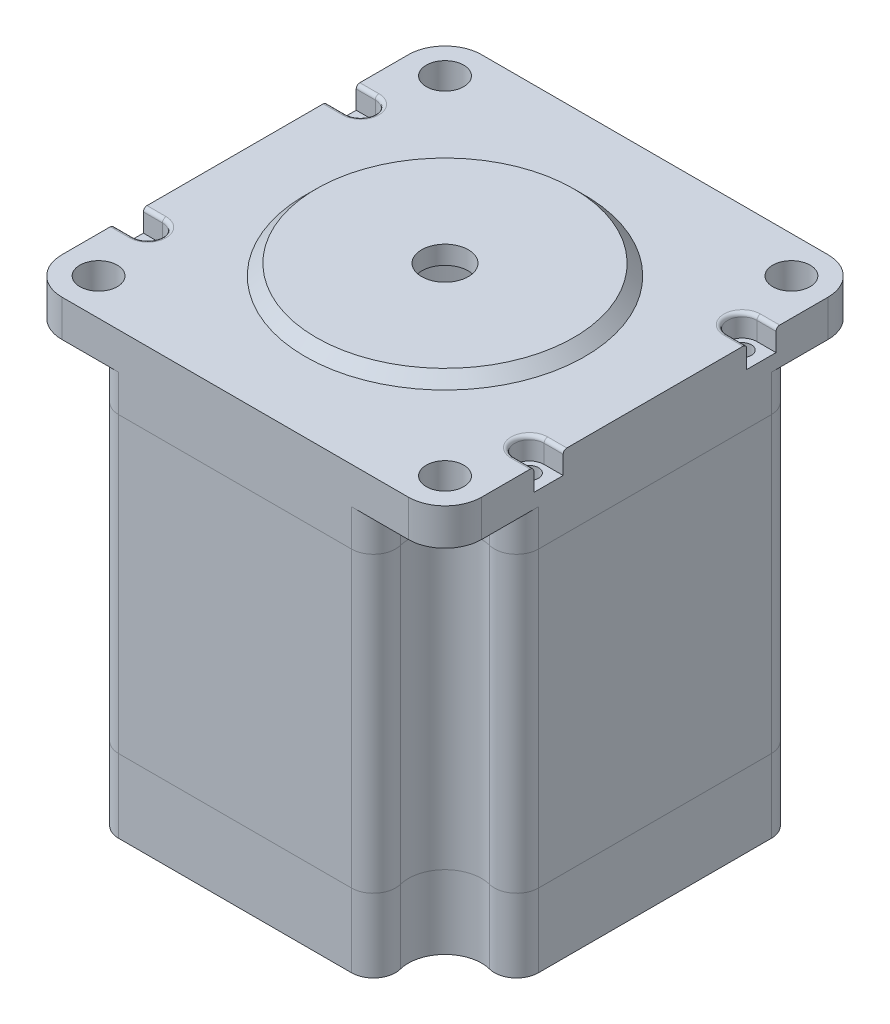
from build123d import *

# Parameters (mm, degrees)
BOSS_EXTRUDE1_DEPTH      = 30
SPLIT1_SURFACE_1_1_BACK  = 101.716
SPLIT1_SURFACE_1_1_DEPTH = 203.432
SPLIT1_SURFACE_1_2_BACK  = 101.716
SPLIT1_SURFACE_1_2_DEPTH = 203.432
SPLIT1_SURFACE_2_3_BACK  = 101.716
SPLIT1_SURFACE_2_3_DEPTH = 203.432
SPLIT1_SURFACE_2_4_BACK  = 101.716
SPLIT1_SURFACE_2_4_DEPTH = 203.432
SKETCH4_R                = 19.05
BOSS_EXTRUDE2_DEPTH      = 1.5
CHAMFER1_SIZE            = 1.5
SKETCH5_R                = 3.18
CUT_EXTRUDE1_DEPTH       = 74.60821964971032
FILLET1_R                = 1.5
CUT_EXTRUDE2_DEPTH       = 55
FILLET2_R                = 3
FILLET3_START            = 19
FILLET3_DEPTH            = 6
FILLET4_R                = 3
MIRROR1_START            = 20
MIRROR1_DEPTH            = 5
MIRROR1_START_2          = -20
MIRROR1_2_DEPTH          = 40
MIRROR1_START_3          = -30
MIRROR1_3_DEPTH          = 10
MIRROR2_START            = 20
MIRROR2_DEPTH            = 5
MIRROR2_START_2          = -20
MIRROR2_2_DEPTH          = 40
MIRROR2_START_3          = -30
MIRROR2_3_DEPTH          = 10
SKETCH7_R                = 2.5499999999999994
CUT_EXTRUDE3_DEPTH       = 73.35965743036655
FILLET5_R                = 5
SKETCH11_R               = 19.05
CUT_EXTRUDE4_DEPTH       = 29
CUT_EXTRUDE6_DEPTH       = 3
FILLET6_R                = 0.5
SKETCH16_R               = 1.2500000000000013
CUT_EXTRUDE8_DEPTH       = 73.35965743036655
CUT_EXTRUDE9_DEPTH       = 5


with BuildPart() as part:
    # Sketch1 → Boss-Extrude1 (new, symmetric)
    with BuildSketch(Plane(origin=(0, 0, 0), x_dir=(1, 0, 0), z_dir=(0, 1, 0))):
        Polygon((28.6, -28.600000000000005), (-28.6, -28.600000000000012), (-28.6, 28.59999999999999), (28.6, 28.599999999999998), align=None)
    extrude(amount=BOSS_EXTRUDE1_DEPTH, both=True)


with BuildPart() as body_2:
    # Split1: the piece behind the surface
    add(part.part)
    # Split1 surface 1: a surface, the sketch's curves swept straight by 203.432 mm
    with BuildLine(Plane(origin=(-3.47e-15, 0, -28.599999999999994), x_dir=(-1, 0, 1.2e-16), z_dir=(-1.2e-16, 0, -1)).offset(-SPLIT1_SURFACE_1_1_BACK), mode=Mode.PRIVATE) as split1_surface_1_1_path:
        Line((-28.600000000000005, 19.999999999999996), (28.599999999999998, 19.999999999999996))
    split1_surface_1_1 = Shell.extrude(split1_surface_1_1_path.wire(), (-1.2e-16 * SPLIT1_SURFACE_1_1_DEPTH, 0 * SPLIT1_SURFACE_1_1_DEPTH, -1 * SPLIT1_SURFACE_1_1_DEPTH))
    split(bisect_by=split1_surface_1_1, keep=Keep.BOTTOM)


with BuildPart() as part_1:
    add(part.part)

    # Split1: split by a surface, the side it looks to stays
    # Split1 surface 1: a surface, the sketch's curves swept straight by 203.432 mm
    with BuildLine(Plane(origin=(-3.47e-15, 0, -28.599999999999994), x_dir=(-1, 0, 1.2e-16), z_dir=(-1.2e-16, 0, -1)).offset(-SPLIT1_SURFACE_1_2_BACK), mode=Mode.PRIVATE) as split1_surface_1_2_path:
        Line((-28.600000000000005, 19.999999999999996), (28.599999999999998, 19.999999999999996))
    split1_surface_1_2 = Shell.extrude(split1_surface_1_2_path.wire(), (-1.2e-16 * SPLIT1_SURFACE_1_2_DEPTH, 0 * SPLIT1_SURFACE_1_2_DEPTH, -1 * SPLIT1_SURFACE_1_2_DEPTH))
    split(bisect_by=split1_surface_1_2, keep=Keep.TOP)

    # Sketch4 → Boss-Extrude2 (add)
    with BuildSketch(Plane(origin=(0, 30, 0), x_dir=(1, 0, 0), z_dir=(0, 1, 0))):
        with Locations(Location((0, 0, 0), (0, 0, 270))):
            Circle(SKETCH4_R)
    extrude(amount=BOSS_EXTRUDE2_DEPTH)

    # Chamfer1
    chamfer1_edges = [part_1.edges().sort_by_distance(p)[0] for p in [
        (5.83e-15, 31.5, -19.05),
    ]]
    chamfer(chamfer1_edges, length=CHAMFER1_SIZE - 0.0001)  # a hair under: the kernel refuses the full size


with BuildPart() as body_3:
    # Split1 2 body 2: the piece behind the surface
    add(body_2.part)
    # Split1 surface 2: a surface, the sketch's curves swept straight by 203.432 mm
    with BuildLine(Plane(origin=(-3.47e-15, 0, -28.599999999999994), x_dir=(-1, 0, 1.2e-16), z_dir=(-1.2e-16, 0, -1)).offset(-SPLIT1_SURFACE_2_3_BACK), mode=Mode.PRIVATE) as split1_surface_2_3_path:
        Line((-28.600000000000005, -19.999999999999996), (28.599999999999998, -19.999999999999996))
    split1_surface_2_3 = Shell.extrude(split1_surface_2_3_path.wire(), (-1.2e-16 * SPLIT1_SURFACE_2_3_DEPTH, 0 * SPLIT1_SURFACE_2_3_DEPTH, -1 * SPLIT1_SURFACE_2_3_DEPTH))
    split(bisect_by=split1_surface_2_3, keep=Keep.BOTTOM)


with BuildPart() as body_2_1:
    add(body_2.part)

    # Split1 2 body 2: split by a surface, the side it looks to stays
    # Split1 surface 2: a surface, the sketch's curves swept straight by 203.432 mm
    with BuildLine(Plane(origin=(-3.47e-15, 0, -28.599999999999994), x_dir=(-1, 0, 1.2e-16), z_dir=(-1.2e-16, 0, -1)).offset(-SPLIT1_SURFACE_2_4_BACK), mode=Mode.PRIVATE) as split1_surface_2_4_path:
        Line((-28.600000000000005, -19.999999999999996), (28.599999999999998, -19.999999999999996))
    split1_surface_2_4 = Shell.extrude(split1_surface_2_4_path.wire(), (-1.2e-16 * SPLIT1_SURFACE_2_4_DEPTH, 0 * SPLIT1_SURFACE_2_4_DEPTH, -1 * SPLIT1_SURFACE_2_4_DEPTH))
    split(bisect_by=split1_surface_2_4, keep=Keep.TOP)


with BuildPart() as cut_extrude1_tool:
    # Sketch5 → Cut-Extrude1 (new, through all)
    with BuildSketch(Plane(origin=(0, 31.5, 0), x_dir=(1, 0, 0), z_dir=(0, 1, 0))):
        with Locations(Location((0, 0, 0), (0, 0, 270))):
            Circle(SKETCH5_R)
    extrude(amount=-CUT_EXTRUDE1_DEPTH)


with BuildPart() as part_2:
    add(part_1.part)

    # Cut-Extrude1: cut by cut_extrude1_tool
    add(cut_extrude1_tool.part, mode=Mode.SUBTRACT)


with BuildPart() as body_2_2:
    add(body_2_1.part)

    # Cut-Extrude1: cut by cut_extrude1_tool
    add(cut_extrude1_tool.part, mode=Mode.SUBTRACT)


with BuildPart() as body_3_1:
    add(body_3.part)

    # Cut-Extrude1: cut by cut_extrude1_tool
    add(cut_extrude1_tool.part, mode=Mode.SUBTRACT)

    # Fillet1
    fillet1_edges = [body_3_1.edges().sort_by_distance(p)[0] for p in [
        (9.7e-16, -30, -3.18),
    ]]
    fillet(fillet1_edges, radius=FILLET1_R)


with BuildPart() as cut_extrude2_tool:
    # Sketch6 → Cut-Extrude2 (new body)
    with BuildSketch(Plane.XZ.offset(30)):
        with BuildLine():
            ThreePointArc((28.6, -23.599999999999994), (20.064466094067267, -20.064466094067242), (23.599999999999998, -28.599999999999984))
            Line((23.6, -28.599999999999998), (28.6, -28.599999999999998))
            Line((28.6, -28.599999999999998), (28.6, -23.599999999999994))
        make_face()
    extrude(amount=-CUT_EXTRUDE2_DEPTH)


with BuildPart() as part_3:
    add(part_2.part)

    # Cut-Extrude2: cut by cut_extrude2_tool
    add(cut_extrude2_tool.part, mode=Mode.SUBTRACT)

    # Fillet3: read off the stored shape, not the designer's step
    # Fillet3 outline → Fillet3 (cut)
    with BuildSketch(Plane(origin=(0, 0, 0), x_dir=(1, 0, 0), z_dir=(0, 1, 0)).offset(FILLET3_START)):
        with BuildLine():
            ThreePointArc((28.6, 23.6), (27.552847075, 20.538137821), (24.85, 18.758770817))
            ThreePointArc((24.85, 18.758770817), (27.437117307, 18.225741553), (28.6, 15.854033308))
            Line((28.6, 15.854033308), (28.6, 23.6))
        make_face()
        with BuildLine():
            ThreePointArc((15.854033308, 28.6), (18.225741553, 27.437117307), (18.758770817, 24.85))
            ThreePointArc((18.758770817, 24.85), (20.538137821, 27.552847075), (23.6, 28.6))
            Line((23.6, 28.6), (15.854033308, 28.6))
        make_face()
    extrude(amount=FILLET3_DEPTH, mode=Mode.SUBTRACT)

    # Mirror1: read off the stored shape, not the designer's step
    # Mirror1 outline → Mirror1 (cut)
    with BuildSketch(Plane(origin=(0, 0, 0), x_dir=(1, 0, 0), z_dir=(0, 1, 0)).offset(MIRROR1_START)):
        with BuildLine():
            Line((-28.6, 28.6), (-28.6, 15.854033308))
            ThreePointArc((-28.6, 15.854033308), (-27.437117307, 18.225741553), (-24.85, 18.758770817))
            ThreePointArc((-24.85, 18.758770817), (-20.064466094, 20.064466094), (-18.758770817, 24.85))
            ThreePointArc((-18.758770817, 24.85), (-18.225741553, 27.437117307), (-15.854033308, 28.6))
            Line((-15.854033308, 28.6), (-28.6, 28.6))
        make_face()
    extrude(amount=MIRROR1_DEPTH, mode=Mode.SUBTRACT)

    # Mirror2: read off the stored shape, not the designer's step
    # Mirror2 outline → Mirror2 (cut)
    with BuildSketch(Plane(origin=(0, 0, 0), x_dir=(1, 0, 0), z_dir=(0, 1, 0)).offset(MIRROR2_START)):
        with BuildLine():
            ThreePointArc((-18.758770817, -24.85), (-20.064466094, -20.064466094), (-24.85, -18.758770817))
            ThreePointArc((-24.85, -18.758770817), (-27.437117307, -18.225741553), (-28.6, -15.854033308))
            Line((-28.6, -15.854033308), (-28.6, -28.6))
            Line((-28.6, -28.6), (-15.854033308, -28.6))
            ThreePointArc((-15.854033308, -28.6), (-18.225741553, -27.437117307), (-18.758770817, -24.85))
        make_face()
        with BuildLine():
            ThreePointArc((18.758770817, -24.85), (18.225741553, -27.437117307), (15.854033308, -28.6))
            Line((15.854033308, -28.6), (28.6, -28.6))
            Line((28.6, -28.6), (28.6, -15.854033308))
            ThreePointArc((28.6, -15.854033308), (27.437117307, -18.225741553), (24.85, -18.758770817))
            ThreePointArc((24.85, -18.758770817), (20.064466094, -20.064466094), (18.758770817, -24.85))
        make_face()
    extrude(amount=MIRROR2_DEPTH, mode=Mode.SUBTRACT)

    # Sketch7 → Cut-Extrude3 (cut, through all)
    with BuildSketch(Plane(origin=(0, 30, 0), x_dir=(1, 0, 0), z_dir=(0, 1, 0))):
        with Locations(Location((-23.6, 23.6, 0), (0, 0, 270))):
            Circle(SKETCH7_R)
        with Locations(Location((23.6, 23.6, 0), (0, 0, 270))):
            Circle(SKETCH7_R)
        with Locations(Location((23.6, -23.60000000000001, 0), (0, 0, 270))):
            Circle(SKETCH7_R)
        with Locations(Location((-23.60000000000001, -23.599999999999994, 0), (0, 0, 270))):
            Circle(SKETCH7_R)
    extrude(amount=-CUT_EXTRUDE3_DEPTH, mode=Mode.SUBTRACT)

    # Fillet5
    fillet5_edges = [part_3.edges().sort_by_distance(p)[0] for p in [
        (-28.6, 27.5, -28.59999999999999),
        (28.6, 27.5, -28.599999999999998),
        (28.6, 27.5, 28.600000000000005),
        (-28.6, 27.5, 28.600000000000012),
    ]]
    fillet(fillet5_edges, radius=FILLET5_R)


with BuildPart() as body_2_3:
    add(body_2_2.part)

    # Cut-Extrude2: cut by cut_extrude2_tool
    add(cut_extrude2_tool.part, mode=Mode.SUBTRACT)

    # Fillet2
    fillet2_edges = [body_2_3.edges().sort_by_distance(p)[0] for p in [
        (23.6, 3.55e-15, -28.59999999999999),
    ]]
    fillet(fillet2_edges, radius=FILLET2_R)
    fillet2_2_edges = [body_2_3.edges().sort_by_distance(p)[0] for p in [
        (28.6, 3.55e-15, -23.599999999999994),
    ]]
    fillet(fillet2_2_edges, radius=FILLET2_R)

    # Mirror1 2 outline → Mirror1 2 (cut)
    with BuildSketch(Plane(origin=(0, 0, 0), x_dir=(1, 0, 0), z_dir=(0, 1, 0)).offset(MIRROR1_START_2)):
        with BuildLine():
            Line((-28.6, 28.6), (-28.6, 15.854033308))
            ThreePointArc((-28.6, 15.854033308), (-27.437117307, 18.225741553), (-24.85, 18.758770817))
            ThreePointArc((-24.85, 18.758770817), (-20.064466094, 20.064466094), (-18.758770817, 24.85))
            ThreePointArc((-18.758770817, 24.85), (-18.225741553, 27.437117307), (-15.854033308, 28.6))
            Line((-15.854033308, 28.6), (-28.6, 28.6))
        make_face()
    extrude(amount=MIRROR1_2_DEPTH, mode=Mode.SUBTRACT)

    # Mirror2 2 outline → Mirror2 2 (cut)
    with BuildSketch(Plane(origin=(0, 0, 0), x_dir=(1, 0, 0), z_dir=(0, 1, 0)).offset(MIRROR2_START_2)):
        with BuildLine():
            ThreePointArc((-18.758770817, -24.85), (-20.064466094, -20.064466094), (-24.85, -18.758770817))
            ThreePointArc((-24.85, -18.758770817), (-27.437117307, -18.225741553), (-28.6, -15.854033308))
            Line((-28.6, -15.854033308), (-28.6, -28.6))
            Line((-28.6, -28.6), (-15.854033308, -28.6))
            ThreePointArc((-15.854033308, -28.6), (-18.225741553, -27.437117307), (-18.758770817, -24.85))
        make_face()
        with BuildLine():
            ThreePointArc((18.758770817, -24.85), (18.225741553, -27.437117307), (15.854033308, -28.6))
            Line((15.854033308, -28.6), (28.6, -28.6))
            Line((28.6, -28.6), (28.6, -15.854033308))
            ThreePointArc((28.6, -15.854033308), (27.437117307, -18.225741553), (24.85, -18.758770817))
            ThreePointArc((24.85, -18.758770817), (20.064466094, -20.064466094), (18.758770817, -24.85))
        make_face()
    extrude(amount=MIRROR2_2_DEPTH, mode=Mode.SUBTRACT)


with BuildPart() as body_3_2:
    add(body_3_1.part)

    # Cut-Extrude2: cut by cut_extrude2_tool
    add(cut_extrude2_tool.part, mode=Mode.SUBTRACT)

    # Fillet4
    fillet4_edges = [body_3_2.edges().sort_by_distance(p)[0] for p in [
        (23.6, -25, -28.59999999999999),
    ]]
    fillet(fillet4_edges, radius=FILLET4_R)
    fillet4_2_edges = [body_3_2.edges().sort_by_distance(p)[0] for p in [
        (28.6, -25, -23.599999999999994),
    ]]
    fillet(fillet4_2_edges, radius=FILLET4_R)

    # Mirror1 3 outline → Mirror1 3 (cut)
    with BuildSketch(Plane(origin=(0, 0, 0), x_dir=(1, 0, 0), z_dir=(0, 1, 0)).offset(MIRROR1_START_3)):
        with BuildLine():
            Line((-28.6, 28.6), (-28.6, 15.854033308))
            ThreePointArc((-28.6, 15.854033308), (-27.437117307, 18.225741553), (-24.85, 18.758770817))
            ThreePointArc((-24.85, 18.758770817), (-20.064466094, 20.064466094), (-18.758770817, 24.85))
            ThreePointArc((-18.758770817, 24.85), (-18.225741553, 27.437117307), (-15.854033308, 28.6))
            Line((-15.854033308, 28.6), (-28.6, 28.6))
        make_face()
    extrude(amount=MIRROR1_3_DEPTH, mode=Mode.SUBTRACT)

    # Mirror2 3 outline → Mirror2 3 (cut)
    with BuildSketch(Plane(origin=(0, 0, 0), x_dir=(1, 0, 0), z_dir=(0, 1, 0)).offset(MIRROR2_START_3)):
        with BuildLine():
            ThreePointArc((-18.758770817, -24.85), (-20.064466094, -20.064466094), (-24.85, -18.758770817))
            ThreePointArc((-24.85, -18.758770817), (-27.437117307, -18.225741553), (-28.6, -15.854033308))
            Line((-28.6, -15.854033308), (-28.6, -28.6))
            Line((-28.6, -28.6), (-15.854033308, -28.6))
            ThreePointArc((-15.854033308, -28.6), (-18.225741553, -27.437117307), (-18.758770817, -24.85))
        make_face()
        with BuildLine():
            ThreePointArc((18.758770817, -24.85), (18.225741553, -27.437117307), (15.854033308, -28.6))
            Line((15.854033308, -28.6), (28.6, -28.6))
            Line((28.6, -28.6), (28.6, -15.854033308))
            ThreePointArc((28.6, -15.854033308), (27.437117307, -18.225741553), (24.85, -18.758770817))
            ThreePointArc((24.85, -18.758770817), (20.064466094, -20.064466094), (18.758770817, -24.85))
        make_face()
    extrude(amount=MIRROR2_3_DEPTH, mode=Mode.SUBTRACT)


with BuildPart() as cut_extrude4_tool:
    # Sketch11 → Cut-Extrude4 (new, symmetric)
    with BuildSketch(Plane(origin=(0, 0, 0), x_dir=(1, 0, 0), z_dir=(0, 1, 0))):
        with Locations(Location((0, 0, 0), (0, 0, 270))):
            Circle(SKETCH11_R)
    extrude(amount=CUT_EXTRUDE4_DEPTH, both=True)


with BuildPart() as part_4:
    add(part_3.part)

    # Cut-Extrude4: cut by cut_extrude4_tool
    add(cut_extrude4_tool.part, mode=Mode.SUBTRACT)

    # Sketch15 → Cut-Extrude6 (cut)
    with BuildSketch(Plane(origin=(0, 30, 0), x_dir=(1, 0, 0), z_dir=(0, 1, 0))):
        with BuildLine():
            ThreePointArc((-25.999999999999996, 12.499999999999996), (-23.999999999999996, 14.499999999999996), (-25.999999999999996, 16.499999999999996))
            Line((-25.999999999999996, 16.499999999999996), (-28.6, 16.499999999999993))
            Line((-28.6, 16.499999999999993), (-28.6, 12.499999999999991))
            Line((-28.6, 12.499999999999991), (-25.999999999999996, 12.499999999999996))
        make_face()
        with BuildLine():
            Line((-25.999999999999993, -12.50000000000001), (-28.599999999999998, -12.500000000000004))
            Line((-28.599999999999998, -12.500000000000004), (-28.599999999999998, -16.500000000000007))
            Line((-28.599999999999998, -16.500000000000007), (-25.999999999999993, -16.50000000000001))
            ThreePointArc((-25.999999999999993, -16.50000000000001), (-24.000000000000007, -14.50000000000001), (-25.999999999999993, -12.500000000000009))
        make_face()
        with BuildLine():
            Line((28.600000000000023, -16.49999999999994), (28.600000000000023, -12.499999999999934))
            Line((28.600000000000023, -12.499999999999934), (26.000000000000018, -12.499999999999948))
            ThreePointArc((26.000000000000018, -12.499999999999948), (23.999999999999957, -14.499999999999948), (26.000000000000018, -16.49999999999995))
            Line((26.000000000000018, -16.49999999999995), (28.600000000000023, -16.49999999999994))
        make_face()
        with BuildLine():
            Line((26.000000000000018, 12.499999999999948), (28.600000000000023, 12.499999999999934))
            Line((28.600000000000023, 12.499999999999934), (28.600000000000023, 16.49999999999994))
            Line((28.600000000000023, 16.49999999999994), (26.000000000000018, 16.49999999999995))
            ThreePointArc((26.000000000000018, 16.49999999999995), (23.99999999999995, 14.499999999999948), (26.000000000000018, 12.499999999999947))
        make_face()
    extrude(amount=-CUT_EXTRUDE6_DEPTH, mode=Mode.SUBTRACT)

    # Fillet6
    fillet6_edges = [part_4.edges().sort_by_distance(p)[0] for p in [
        (23.99999999999995, 30, -14.499999999999948),
        (27.30000000000002, 30, -16.499999999999947),
        (27.30000000000002, 30, -12.499999999999941),
        (27.30000000000002, 30, 12.499999999999941),
        (23.999999999999957, 30, 14.49999999999995),
        (27.30000000000002, 30, 16.499999999999943),
        (-24.000000000000007, 30, 14.50000000000001),
        (-27.299999999999997, 30, 16.500000000000007),
        (-27.299999999999997, 30, 12.500000000000007),
        (-27.299999999999997, 30, -12.499999999999995),
        (-23.999999999999996, 30, -14.499999999999996),
        (-27.299999999999997, 30, -16.499999999999993),
    ]]
    fillet(fillet6_edges, radius=FILLET6_R)


with BuildPart() as body_2_4:
    add(body_2_3.part)

    # Cut-Extrude4: cut by cut_extrude4_tool
    add(cut_extrude4_tool.part, mode=Mode.SUBTRACT)


with BuildPart() as body_3_3:
    add(body_3_2.part)

    # Cut-Extrude4: cut by cut_extrude4_tool
    add(cut_extrude4_tool.part, mode=Mode.SUBTRACT)


with BuildPart() as cut_extrude8_tool:
    # Sketch16 → Cut-Extrude8 (new, through all)
    with BuildSketch(Plane(origin=(0, 30, 0), x_dir=(1, 0, 0), z_dir=(0, 1, 0))):
        with Locations(Location((-25.999999999999996, -14.500000000000004, 0), (0, 0, 270))):
            Circle(SKETCH16_R)
        with Locations(Location((-25.999999999999996, 14.499999999999996, 0), (0, 0, 270))):
            Circle(SKETCH16_R)
        with Locations(Location((26.000000000000004, 14.500000000000004, 0), (0, 0, 270))):
            Circle(SKETCH16_R)
        with Locations(Location((26.000000000000004, -14.499999999999996, 0), (0, 0, 270))):
            Circle(SKETCH16_R)
    extrude(amount=-CUT_EXTRUDE8_DEPTH)


with BuildPart() as part_5:
    add(part_4.part)

    # Cut-Extrude8: cut by cut_extrude8_tool
    add(cut_extrude8_tool.part, mode=Mode.SUBTRACT)


with BuildPart() as body_2_5:
    add(body_2_4.part)

    # Cut-Extrude8: cut by cut_extrude8_tool
    add(cut_extrude8_tool.part, mode=Mode.SUBTRACT)


with BuildPart() as body_3_4:
    add(body_3_3.part)

    # Cut-Extrude8: cut by cut_extrude8_tool
    add(cut_extrude8_tool.part, mode=Mode.SUBTRACT)

    # Sketch17 → Cut-Extrude9 (cut)
    with BuildSketch(Plane(origin=(-3.47e-15, 0, -28.599999999999994), x_dir=(-1, 0, 1.2e-16), z_dir=(-1.2e-16, 0, -1))):
        Polygon((-12.499999999999998, -19.999999999999993), (12.499999999999998, -19.999999999999993), (12.5, -26.99999999999999), (-12.5, -26.999999999999993), align=None)
    extrude(amount=-CUT_EXTRUDE9_DEPTH, mode=Mode.SUBTRACT)


solid = Compound([part_5.part, body_2_5.part, body_3_4.part])
